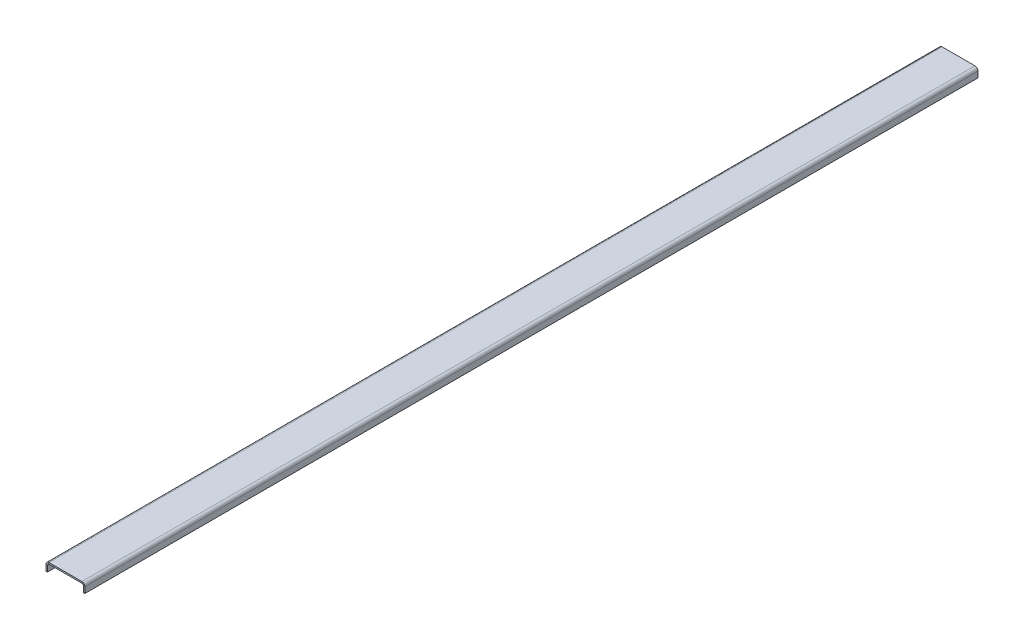
from build123d import *

# Parameters (mm, degrees)
TABAN_FLAN_1_DEPTH = 2990


# Sheet-metal steps are written as plain solids
with BuildPart() as part:
    # Çizim1 → Taban-Flanş1 (new body)
    with BuildSketch(Plane.XY):
        with BuildLine():
            Line((0, 0), (0, 20))
            ThreePointArc((0, 20), (2.928932188, 27.071067812), (10, 30))
            Line((10, 30), (120, 30))
            ThreePointArc((120, 30), (127.071067812, 27.071067812), (130, 20))
            Line((130, 20), (130, 0))
            Line((130, 0), (125, 0))
            Line((125, 0), (125, 20))
            ThreePointArc((125, 20), (123.535533906, 23.535533906), (120, 25))
            Line((120, 25), (10, 25))
            ThreePointArc((10, 25), (6.464466094, 23.535533906), (5, 20))
            Line((5, 20), (5, 0))
            Line((5, 0), (0, 0))
        make_face()
    extrude(amount=TABAN_FLAN_1_DEPTH)


solid = part.part
